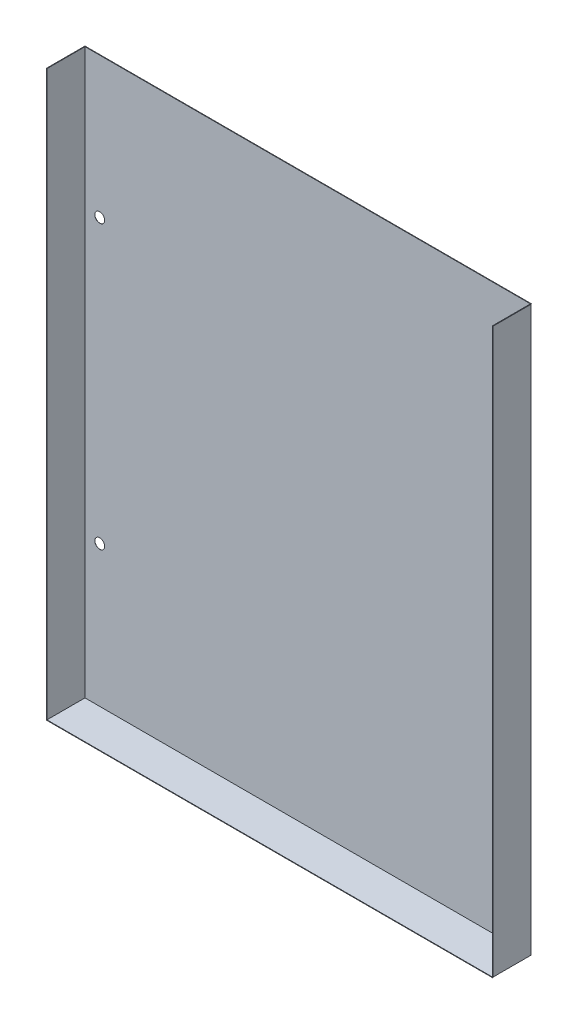
from build123d import *

# Parameters (mm, degrees)
SKETCH1_W             = 89.6514
SKETCH1_H             = 226.9314
SKETCH1_R             = 2
HEAT_EXCHANGER_DEPTH  = 0.0686
CONVECTION_FINS_DEPTH = 15.29686
TOP_OVERWRAP_DEPTH    = 0.0686
SIDE_OVERWRAP_DEPTH   = 0.0686


with BuildPart() as part:
    # Sketch1 → Heat Exchanger (new body)
    with BuildSketch(Plane.XY):
        with Locations((-44.8257, 0)):
            Rectangle(SKETCH1_W, SKETCH1_H)
        with Locations((-83.71996294, -56.7081132)):
            Circle(SKETCH1_R, mode=Mode.SUBTRACT)
        with Locations((-83.71996294, 56.94427919)):
            Circle(SKETCH1_R, mode=Mode.SUBTRACT)
    heat_exchanger = extrude(amount=HEAT_EXCHANGER_DEPTH)

    # Sketch3 → Convection Fins (add)
    with BuildSketch(Plane.XY):
        Polygon((0, -113.5343), (0, -113.4657), (-89.6514, -113.4657), (-89.6514, 113.4657), (-89.72, 113.4657), (-89.72, -113.5343), align=None)
    convection_fins = extrude(amount=CONVECTION_FINS_DEPTH)

    # Sketch5 → Top Overwrap (add)
    with BuildSketch(Plane(origin=(0, 113.4657, 0), x_dir=(1, 0, 0), z_dir=(0, 1, 0))):
        Polygon((-89.8724, -15.29686), (-89.6514, -15.29686), (-89.6514, -0.0686), (0, -0.0686), (0, 0.1524), (-89.8724, 0.1524), align=None)
    top_overwrap = extrude(amount=TOP_OVERWRAP_DEPTH)

    # Sketch7 → Side Overwrap (add)
    with BuildSketch(Plane.XY.offset(15.29686)):
        Polygon((-89.8724, 113.5343), (-89.6514, 113.5343), (-89.6514, -113.4657), (0, -113.4657), (0, -113.6867), (-89.8724, -113.6867), align=None)
    side_overwrap = extrude(amount=SIDE_OVERWRAP_DEPTH)

    # Mirror1: Heat Exchanger, Convection Fins, Top Overwrap, Side Overwrap across plane
    add(heat_exchanger.mirror(Plane(origin=(0, 0, 0), x_dir=(0, 0, 1), z_dir=(1, 0, 0))))
    add(convection_fins.mirror(Plane(origin=(0, 0, 0), x_dir=(0, 0, 1), z_dir=(1, 0, 0))))
    add(top_overwrap.mirror(Plane(origin=(0, 0, 0), x_dir=(0, 0, 1), z_dir=(1, 0, 0))))
    add(side_overwrap.mirror(Plane(origin=(0, 0, 0), x_dir=(0, 0, 1), z_dir=(1, 0, 0))))


solid = part.part
